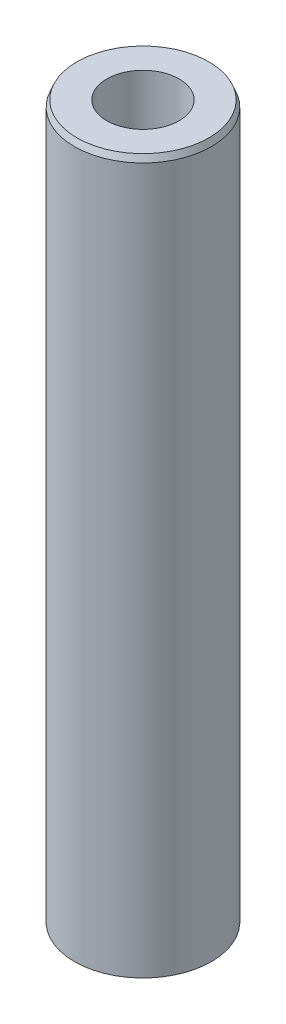
from build123d import *
from OCP.BRepFilletAPI import BRepFilletAPI_MakeChamfer

# Parameters (mm, degrees)
SKETCH1_R           = 57.5
BOSS_EXTRUDE1_DEPTH = 600
SKETCH2_R           = 30.409368041
CUT_EXTRUDE1_DEPTH  = 606.485342515
CHAMFER1_SIZE       = 5.288970012
CHAMFER1_SIZE2      = 2.151261121


with BuildPart() as part:
    # Sketch1 → Boss-Extrude1 (new body)
    with BuildSketch(Plane(origin=(0, 0, 0), x_dir=(1, 0, 0), z_dir=(0, 1, 0))):
        Circle(SKETCH1_R)
    extrude(amount=BOSS_EXTRUDE1_DEPTH)

    # Sketch2 → Cut-Extrude1 (cut, through all)
    with BuildSketch(Plane(origin=(0, 0, 0), x_dir=(1, 0, 0), z_dir=(0, 1, 0))):
        Circle(SKETCH2_R)
    extrude(amount=CUT_EXTRUDE1_DEPTH, mode=Mode.SUBTRACT)

    # Chamfer1: one chamfer whose edges measure the first distance from different faces: ONE call of the kernel's chamfer builder (chamfer() names one face for all edges)
    chamfer1_edges_1 = [part.edges().sort_by_distance(p)[0] for p in [
        (-57.5, 600, 0),
    ]]
    chamfer1_side_1 = [part.faces().sort_by_distance(p)[0] for p in [
        (-57.5, 300, 0),
    ]]
    chamfer1_edges_2 = [part.edges().sort_by_distance(p)[0] for p in [
        (-57.5, 0, 0),
    ]]
    chamfer1_side_2 = [part.faces().sort_by_distance(p)[0] for p in [
        (-55.873654403, 0, 0),
    ]]
    chamfer1 = BRepFilletAPI_MakeChamfer(part.part.solid().wrapped)
    for e in chamfer1_edges_1:
        chamfer1.Add(CHAMFER1_SIZE, CHAMFER1_SIZE2, e.wrapped, chamfer1_side_1[0].wrapped)  # the first distance lies on this face
    for e in chamfer1_edges_2:
        chamfer1.Add(CHAMFER1_SIZE, CHAMFER1_SIZE2, e.wrapped, chamfer1_side_2[0].wrapped)  # the first distance lies on this face
    add(Compound.cast(chamfer1.Shape()), mode=Mode.REPLACE)


solid = part.part
